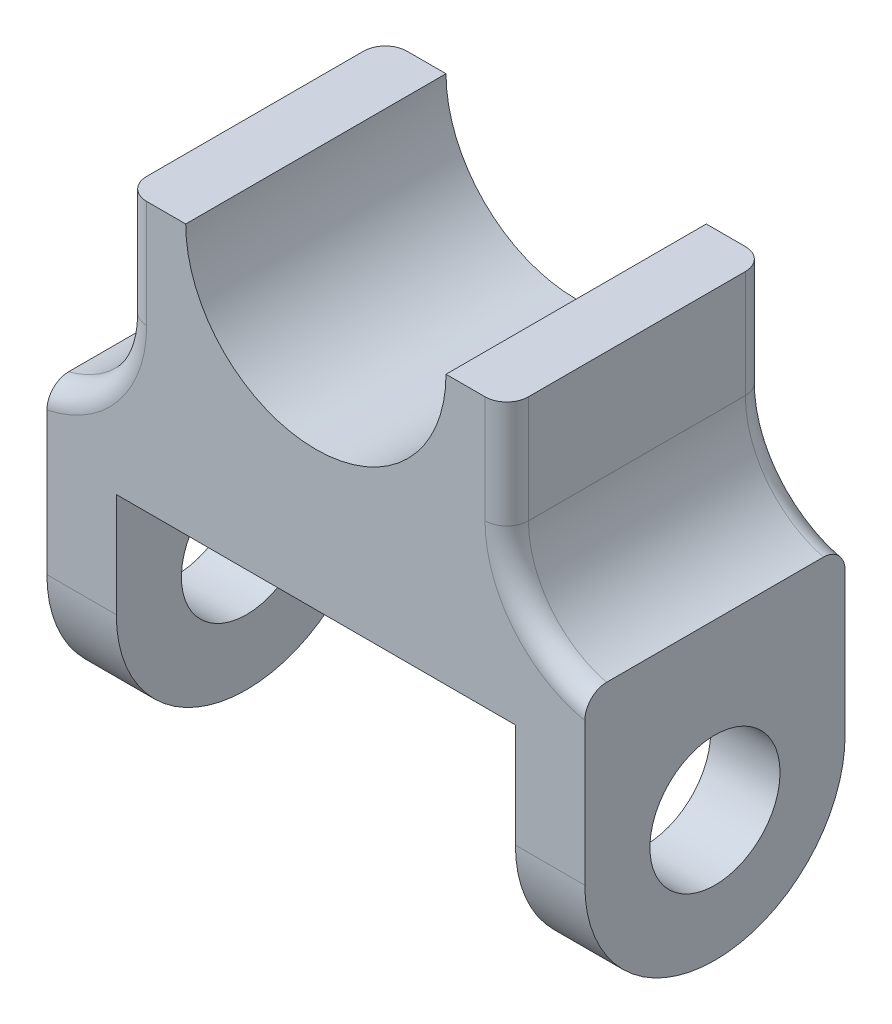
from build123d import *

# Parameters (mm, degrees)
BOSS_EXTRUDE1_DEPTH      = 30
BOSS_EXTRUDE1_DEPTH_BACK = 30
FILLET1_R                = 5
SKETCH2_R                = 15
CUT_EXTRUDE1_DEPTH       = 124
FILLET2_R                = 30


with BuildPart() as part:
    # Sketch1 → Boss-Extrude1 (new, two sides: drawn at the far end of the back side and taken through both)
    with BuildSketch(Plane.XY.offset(-BOSS_EXTRUDE1_DEPTH_BACK)):
        with BuildLine():
            Line((108, 0), (124, 0))
            Line((124, 0), (124, 68))
            ThreePointArc((124, 68), (111.026334039, 76.540961621), (106, 91.237900077))
            Line((106, 91.237900077), (106, 116))
            Line((106, 116), (92, 116))
            ThreePointArc((92, 116), (62, 86), (32, 116))
            Line((32, 116), (18, 116))
            Line((18, 116), (18, 91.237900077))
            ThreePointArc((18, 91.237900077), (12.973665961, 76.540961621), (0, 68))
            Line((0, 68), (0, 0))
            Line((0, 0), (16, 0))
            Line((16, 0), (16, 54))
            Line((16, 54), (108, 54))
            Line((108, 54), (108, 0))
        make_face()
    extrude(amount=BOSS_EXTRUDE1_DEPTH + BOSS_EXTRUDE1_DEPTH_BACK)

    # Fillet1
    fillet1_edges = [part.edges().sort_by_distance(p)[0] for p in [
        (106, 103.618950039, -30),
        (111.026334039, 76.540961621, -30),
        (18, 103.618950039, 30),
        (12.973665961, 76.540961621, 30),
        (12.973665961, 76.540961621, -30),
        (111.026334039, 76.540961621, 30),
        (106, 103.618950039, 30),
        (18, 103.618950039, -30),
    ]]
    fillet(fillet1_edges, radius=FILLET1_R)

    # Sketch2 → Cut-Extrude1 (cut)
    with BuildSketch(Plane(origin=(124, 0, 0), x_dir=(0, 0, -1), z_dir=(1, 0, 0))):
        with Locations((0, 30)):
            Circle(SKETCH2_R)
    extrude(amount=-CUT_EXTRUDE1_DEPTH, mode=Mode.SUBTRACT)

    # Fillet2
    fillet2_edges = [part.edges().sort_by_distance(p)[0] for p in [
        (116, 0, -30),
        (116, 0, 30),
        (8, 0, -30),
        (8, 0, 30),
    ]]
    fillet(fillet2_edges, radius=FILLET2_R - 0.0001)  # a hair under: the kernel refuses the full size


solid = part.part
